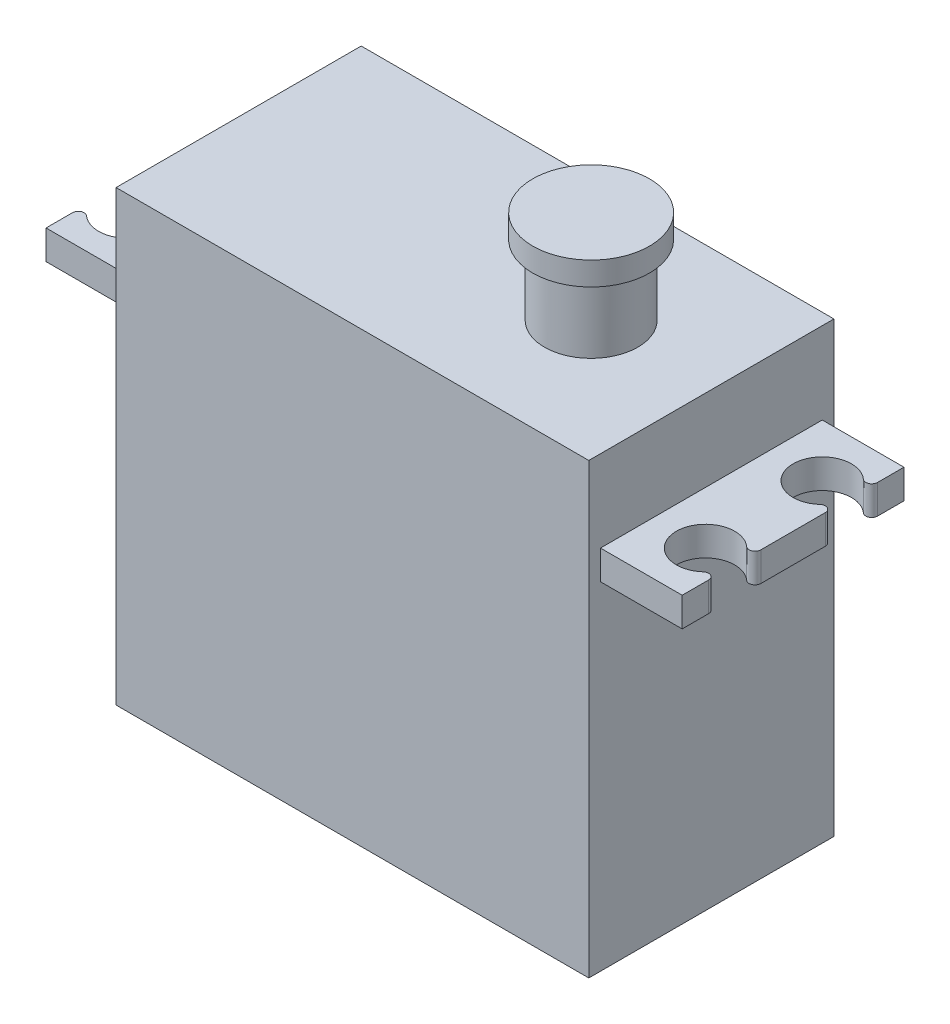
from build123d import *

# Parameters (mm, degrees)
SKETCH1_W           = 40.5
SKETCH1_H           = 21
BOSS_EXTRUDE1_DEPTH = 38.4
SKETCH2_R           = 4
BOSS_EXTRUDE2_DEPTH = 6
SKETCH3_R           = 5
BOSS_EXTRUDE3_DEPTH = 2
BOSS_EXTRUDE5_START = 15.5
BOSS_EXTRUDE5_DEPTH = 2.5


with BuildPart() as part:
    # Sketch1 → Boss-Extrude1 (new body)
    with BuildSketch(Plane(origin=(0, 0, 0), x_dir=(1, 0, 0), z_dir=(0, 1, 0))):
        Rectangle(SKETCH1_W, SKETCH1_H)
    extrude(amount=BOSS_EXTRUDE1_DEPTH)

    # Sketch2 → Boss-Extrude2 (add)
    with BuildSketch(Plane(origin=(0, 38.4, 0), x_dir=(1, 0, 0), z_dir=(0, 1, 0))):
        with Locations((9.95, 0)):
            Circle(SKETCH2_R)
    extrude(amount=BOSS_EXTRUDE2_DEPTH)

    # Sketch6 → Boss-Extrude5 (add)
    with BuildSketch(Plane.XZ.offset(-44.4).offset(BOSS_EXTRUDE5_START)):
        with BuildLine():
            Line((-27.25, -7.236067977), (-27.25, -9.5))
            Line((-27.25, -9.5), (27.25, -9.5))
            Line((27.25, -9.5), (27.25, -7.236067977))
            ThreePointArc((27.25, -7.236067977), (26.954124145, -6.779632513), (26.416666667, -6.863389981))
            ThreePointArc((26.416666667, -6.863389981), (22.25, -5), (26.416666667, -3.136610019))
            ThreePointArc((26.416666667, -3.136610019), (26.954124145, -3.220367487), (27.25, -2.763932023))
            Line((27.25, -2.763932023), (27.25, 2.763932023))
            ThreePointArc((27.25, 2.763932023), (26.954124145, 3.220367487), (26.416666667, 3.136610019))
            ThreePointArc((26.416666667, 3.136610019), (22.25, 5), (26.416666667, 6.863389981))
            ThreePointArc((26.416666667, 6.863389981), (26.954124145, 6.779632513), (27.25, 7.236067977))
            Line((27.25, 7.236067977), (27.25, 9.5))
            Line((27.25, 9.5), (-27.25, 9.5))
            Line((-27.25, 9.5), (-27.25, 7.236067977))
            ThreePointArc((-27.25, 7.236067977), (-26.954124145, 6.779632513), (-26.416666667, 6.863389981))
            ThreePointArc((-26.416666667, 6.863389981), (-22.25, 5), (-26.416666667, 3.136610019))
            ThreePointArc((-26.416666667, 3.136610019), (-26.954124145, 3.220367487), (-27.25, 2.763932023))
            Line((-27.25, 2.763932023), (-27.25, -2.763932023))
            ThreePointArc((-27.25, -2.763932023), (-26.954124145, -3.220367487), (-26.416666667, -3.136610019))
            ThreePointArc((-26.416666667, -3.136610019), (-22.25, -5), (-26.416666667, -6.863389981))
            ThreePointArc((-26.416666667, -6.863389981), (-26.954124145, -6.779632513), (-27.25, -7.236067977))
        make_face()
    extrude(amount=-BOSS_EXTRUDE5_DEPTH)


with BuildPart() as body_2:
    # Sketch3 → Boss-Extrude3 (new body)
    with BuildSketch(Plane(origin=(0, 44.4, 0), x_dir=(1, 0, 0), z_dir=(0, 1, 0))):
        with Locations((9.95, 0)):
            Circle(SKETCH3_R)
    extrude(amount=BOSS_EXTRUDE3_DEPTH)


solid = Compound([part.part, body_2.part])
